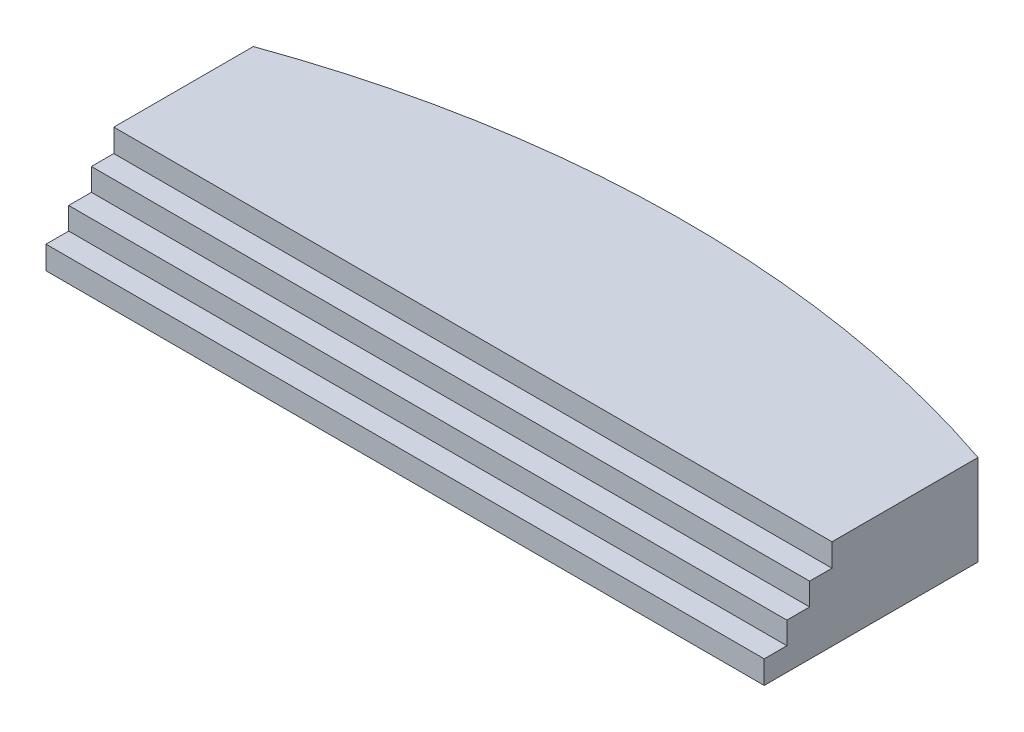
from build123d import *

# Parameters (mm, degrees)
BOSS_EXTRUDE1_DEPTH = 1000
CUT_EXTRUDE1_DEPTH  = 24000


with BuildPart() as part:
    # Sketch1 → Boss-Extrude1 (new body)
    with BuildSketch(Plane(origin=(0, 0, 0), x_dir=(1, 0, 0), z_dir=(0, 1, 0))):
        with BuildLine():
            Line((-4067.116172071, 9000), (3864.123361974, 9000))
            Line((3864.123361974, 9000), (3864.123361974, 11360.834064603))
            ThreePointArc((3864.123361974, 11360.834064603), (1958.314482503, 11839.130220908), (0, 12000))
            ThreePointArc((0, 12000), (-2064.332945394, 11821.105256725), (-4067.116172071, 11289.754915094))
            Line((-4067.116172071, 11289.754915094), (-4067.116172071, 9000))
        make_face()
    extrude(amount=BOSS_EXTRUDE1_DEPTH)

    # Sketch2 → Cut-Extrude1 (cut)
    with BuildSketch(Plane(origin=(3864.123361974, 0, 0), x_dir=(0, 0, -1), z_dir=(1, 0, 0))):
        Polygon((9000, 254.910429711), (9250.24574489, 254.910429711), (9250.24574489, 500), (9501.411916095, 500), (9501.411916095, 747.115103928), (9748.527020023, 747.115103928), (9748.527020023, 1000), (9000, 1000), align=None)
    extrude(amount=-CUT_EXTRUDE1_DEPTH, mode=Mode.SUBTRACT)


solid = part.part
